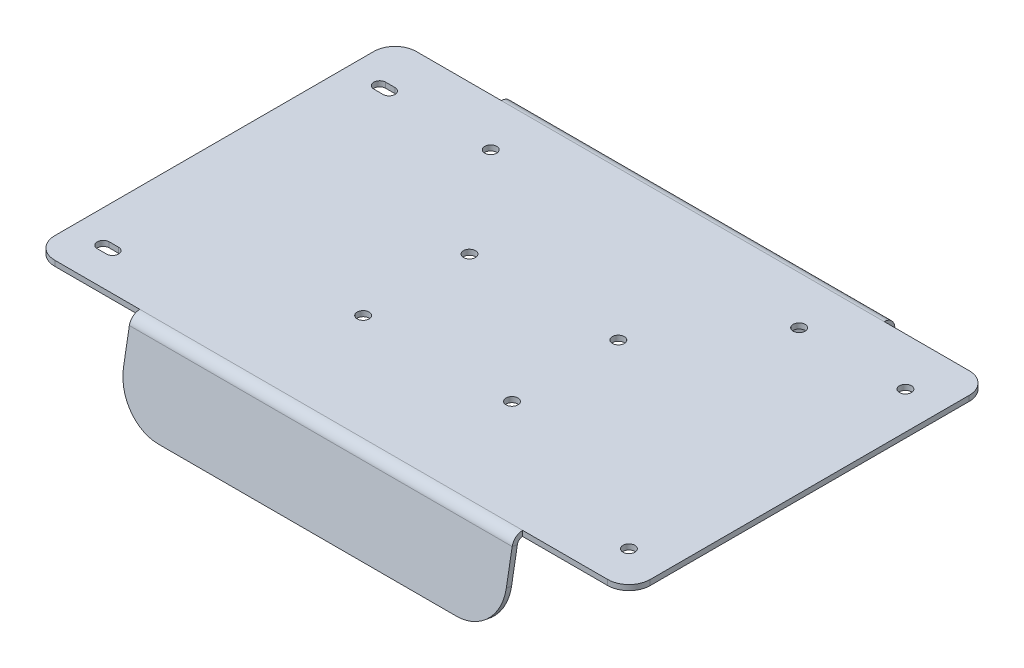
from build123d import *

# Parameters (mm, degrees)
SKETCH1_W                   = 355.6
SKETCH1_H                   = 215.9
BOSS_EXTRUDE1_DEPTH         = 6.35
CONVERT_SOLID1_OUTLINE_W    = 355.6
CONVERT_SOLID1_OUTLINE_H    = 215.9
CONVERT_SOLID1_DEPTH        = 3.175
F_1_4_CLEARANCE_HOLE1_D     = 7.14248
F_1_4_START                 = 3.175
F_1_4_CLEARANCE_SLOT1_DEPTH = 3.175
EDGE_FLANGE2_DEPTH          = 228.6
EDGE_FLANGE2_BEND_DEPTH     = 228.6
FILLET1_R                   = 12.7
FILLET2_R                   = 25.4


# Read off the part's stored shape, not the designer's step: Convert-Solid1, 1/4 Clearance Slot1
# Sheet-metal steps are written as plain solids
with BuildPart() as part:
    # Sketch1 → Boss-Extrude1 (new body)
    with BuildSketch(Plane(origin=(0, 0, 0), x_dir=(1, 0, 0), z_dir=(0, 1, 0))):
        Rectangle(SKETCH1_W, SKETCH1_H)
    extrude(amount=BOSS_EXTRUDE1_DEPTH)

    # Convert-Solid1 outline → Convert-Solid1 (cut)
    with BuildSketch(Plane(origin=(0, 0, 0), x_dir=(1, 0, 0), z_dir=(0, 1, 0))):
        Rectangle(CONVERT_SOLID1_OUTLINE_W, CONVERT_SOLID1_OUTLINE_H)
    extrude(amount=CONVERT_SOLID1_DEPTH, mode=Mode.SUBTRACT)

    # 1/4 Clearance Hole1 (through all)
    with Locations(Plane(origin=(0, 6.35, 0), x_dir=(1, 0, 0), z_dir=(0, 1, 0))):
        with Locations((-92.075, 79.375), (-44.45, 19.05), (44.45, 19.05), (-44.45, -44.45), (44.45, -44.45), (92.075, 79.375), (155.575, 79.375), (155.575, -85.725)):
            Hole(F_1_4_CLEARANCE_HOLE1_D / 2)

    # 1/4 Clearance Slot1 outline → 1/4 Clearance Slot1 (cut)
    with BuildSketch(Plane(origin=(0, 0, 0), x_dir=(1, 0, 0), z_dir=(0, 1, 0)).offset(F_1_4_START)):
        with BuildLine():
            Line((-158.35376, -89.29624), (-152.79624, -89.29624))
            ThreePointArc((-152.79624, -89.29624), (-149.225, -85.725), (-152.79624, -82.15376))
            Line((-152.79624, -82.15376), (-158.35376, -82.15376))
            ThreePointArc((-158.35376, -82.15376), (-161.925, -85.725), (-158.35376, -89.29624))
        make_face()
        with BuildLine():
            Line((-158.35376, 75.80376), (-152.79624, 75.80376))
            ThreePointArc((-152.79624, 75.80376), (-149.225, 79.375), (-152.79624, 82.94624))
            Line((-152.79624, 82.94624), (-158.35376, 82.94624))
            ThreePointArc((-158.35376, 82.94624), (-161.925, 79.375), (-158.35376, 75.80376))
        make_face()
    extrude(amount=F_1_4_CLEARANCE_SLOT1_DEPTH, mode=Mode.SUBTRACT)

    # Edge-Flange2 section (across the edge) → Edge-Flange2 (add)
    with BuildSketch(Plane(origin=(-114.3, 3.175, -110.614141329), x_dir=(0, -0.17364817766693427, 0.9848077530122075), z_dir=(1, 0, 0))):
        with BuildLine():
            Line((-3.175, 2.664141329), (-3.175, 48.135858671))
            Line((-3.175, 48.135858671), (0, 48.135858671))
            Line((0, 48.135858671), (0, 2.664141329))
            ThreePointArc((0, 2.664141329), (0.742808893, 0.623290668), (2.623667036, -0.462623287))
            Line((2.623667036, -0.462623287), (2.072334072, -3.589387903))
            ThreePointArc((2.072334072, -3.589387903), (-1.689382214, -1.417559993), (-3.175, 2.664141329))
        make_face()
    extrude(amount=EDGE_FLANGE2_DEPTH)

    # Edge-Flange2 section 2 (across the edge) → Edge-Flange2 bend (add)
    with BuildSketch(Plane(origin=(114.3, 3.175, 110.614141329), x_dir=(0, -0.17364817766693427, -0.9848077530122075), z_dir=(-1, 0, 0))):
        with BuildLine():
            Line((-3.175, 2.664141329), (-3.175, 48.135858671))
            Line((-3.175, 48.135858671), (0, 48.135858671))
            Line((0, 48.135858671), (0, 2.664141329))
            ThreePointArc((0, 2.664141329), (0.742808893, 0.623290668), (2.623667036, -0.462623287))
            Line((2.623667036, -0.462623287), (2.072334072, -3.589387903))
            ThreePointArc((2.072334072, -3.589387903), (-1.689382214, -1.417559993), (-3.175, 2.664141329))
        make_face()
    extrude(amount=EDGE_FLANGE2_BEND_DEPTH)

    # Fillet1
    fillet1_edges = [part.edges().sort_by_distance(p)[0] for p in [
        (177.8, 4.7625, -107.95),
        (177.8, 4.7625, 107.95),
        (-177.8, 4.7625, 107.95),
        (-177.8, 4.7625, -107.95),
    ]]
    fillet(fillet1_edges, radius=FILLET1_R)

    # Fillet2
    fillet2_edges = [part.edges().sort_by_distance(p)[0] for p in [
        (-114.3, -43.953900335, -120.536227776),
        (114.3, -43.953900335, -120.536227776),
        (114.3, -43.953900335, 120.536227776),
        (-114.3, -43.953900335, 120.536227776),
    ]]
    fillet(fillet2_edges, radius=FILLET2_R)


solid = part.part
